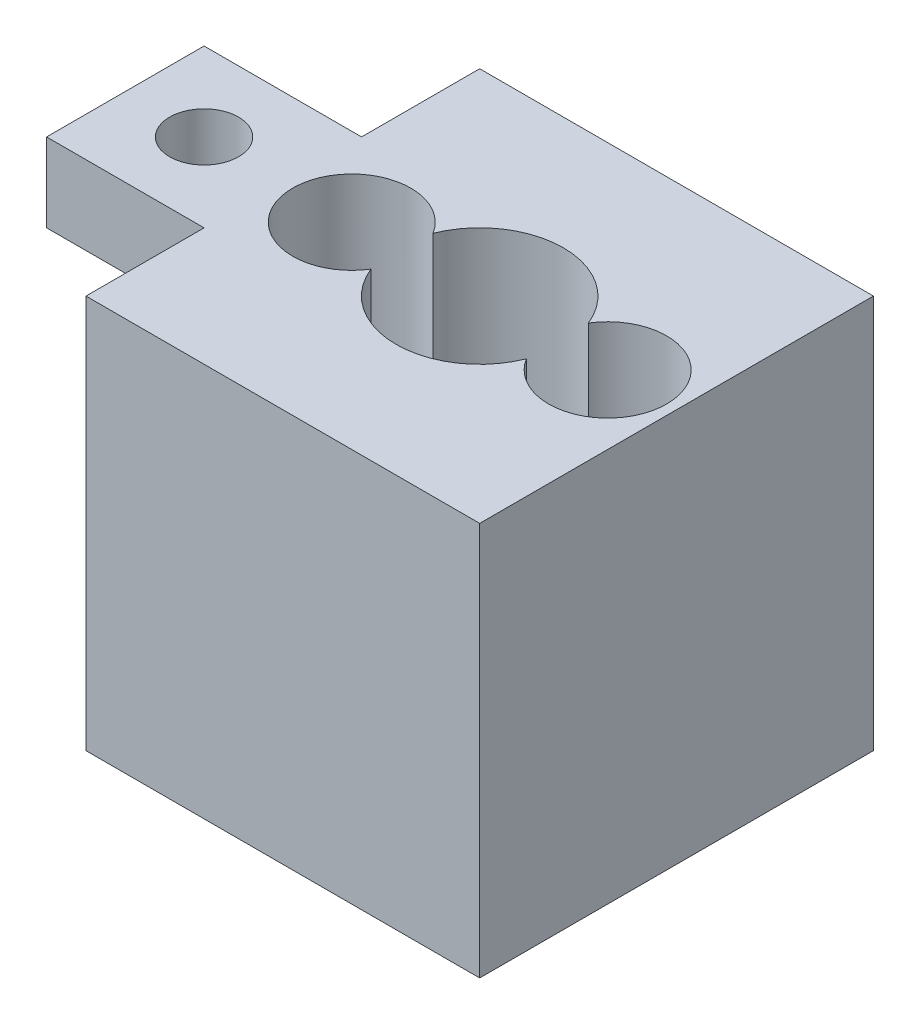
from build123d import *

# Parameters (mm, degrees)
SKETCH1_W               = 20
SKETCH1_H               = 20
BOSS_EXTRUDE1_DEPTH     = 20
SKETCH2_R               = 4.25
CUT_EXTRUDE1_DEPTH      = 10
SKETCH3_R               = 1.75
CUT_EXTRUDE2_DEPTH      = 25.494897428
SKETCH4_R               = 3
CUT_EXTRUDE3_DEPTH      = 15
SKETCH5_W               = 8
SKETCH5_H               = 4
BOSS_EXTRUDE2_DEPTH     = 8
CUT_EXTRUDE4_DEPTH      = 27.076809621
CUT_EXTRUDE4_DEPTH_BACK = 27.076809621
SKETCH6_R               = 1.75


with BuildPart() as part:
    # Sketch1 → Boss-Extrude1 (new body)
    with BuildSketch(Plane(origin=(0, 0, 0), x_dir=(1, 0, 0), z_dir=(0, 1, 0))):
        Rectangle(SKETCH1_W, SKETCH1_H)
    extrude(amount=BOSS_EXTRUDE1_DEPTH)

    # Sketch2 → Cut-Extrude1 (cut)
    with BuildSketch(Plane(origin=(0, 20, 0), x_dir=(1, 0, 0), z_dir=(0, 1, 0))):
        Circle(SKETCH2_R)
    extrude(amount=-CUT_EXTRUDE1_DEPTH, mode=Mode.SUBTRACT)

    # Sketch3 → Cut-Extrude2 (cut, through all)
    with BuildSketch(Plane(origin=(0, 20, 0), x_dir=(1, 0, 0), z_dir=(0, 1, 0))):
        with Locations((-6.5, 0)):
            Circle(SKETCH3_R)
        with Locations((6.5, 0)):
            Circle(SKETCH3_R)
    extrude(amount=-CUT_EXTRUDE2_DEPTH, mode=Mode.SUBTRACT)

    # Sketch4 → Cut-Extrude3 (cut)
    with BuildSketch(Plane(origin=(0, 20, 0), x_dir=(1, 0, 0), z_dir=(0, 1, 0))):
        with Locations((-6.5, 0)):
            Circle(SKETCH4_R)
        with Locations((6.5, 0)):
            Circle(SKETCH4_R)
    extrude(amount=-CUT_EXTRUDE3_DEPTH, mode=Mode.SUBTRACT)

    # Sketch5 → Boss-Extrude2 (add)
    with BuildSketch(Plane.ZY.offset(10)):
        with Locations((0, 18)):
            Rectangle(SKETCH5_W, SKETCH5_H)
    extrude(amount=BOSS_EXTRUDE2_DEPTH)

    # Sketch6 → Cut-Extrude4 (cut, two sides: drawn at the far end of the back side and taken through both)
    with BuildSketch(Plane.XZ.offset(-16).offset(-CUT_EXTRUDE4_DEPTH_BACK)):
        with Locations((-14, 0)):
            Circle(SKETCH6_R)
    extrude(amount=CUT_EXTRUDE4_DEPTH + CUT_EXTRUDE4_DEPTH_BACK, mode=Mode.SUBTRACT)


solid = part.part
